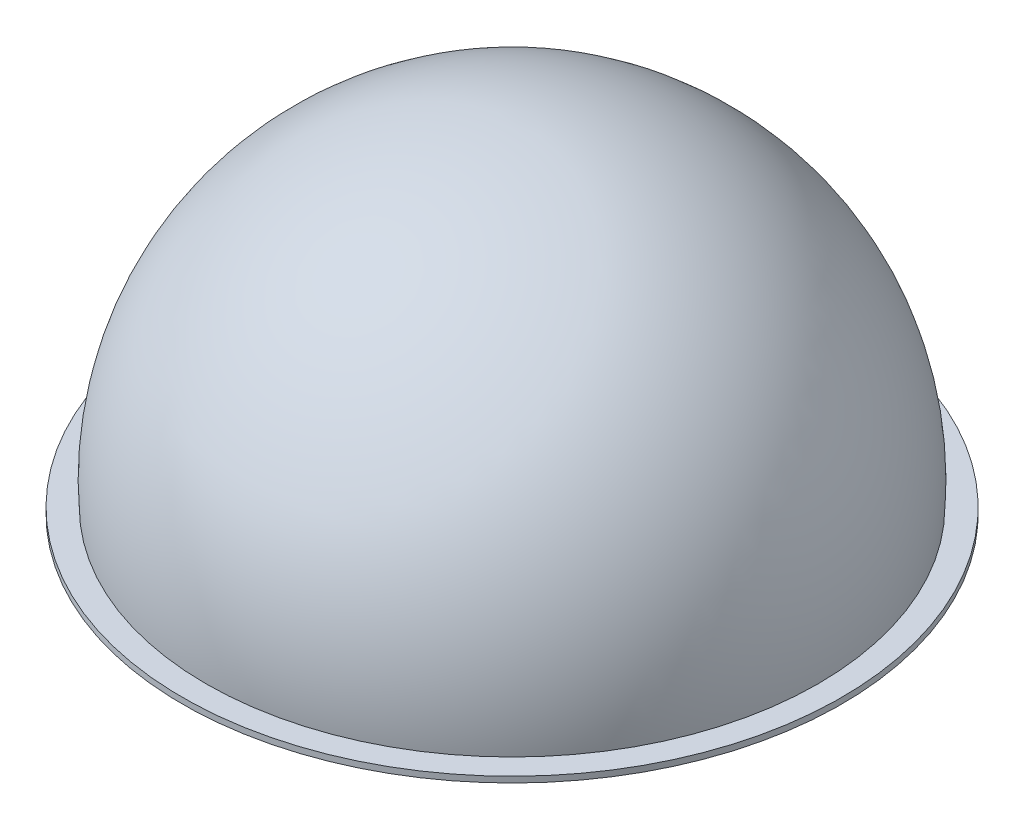
from build123d import *

# Parameters (mm, degrees)
SKETCH3_R           = 177.8
BOSS_EXTRUDE1_DEPTH = 3.175


# Read off the part's stored shape, not the designer's step: Shell1
with BuildPart() as part:
    # Sketch1 → Revolve1 (revolve)
    with BuildSketch(Plane.XY):
        with BuildLine():
            Line((0, 177.8), (0, 0))
            Line((0, 0), (165.1, 0))
            ThreePointArc((165.1, 0), (121.316579658, 124.897538254), (0, 177.8))
        make_face()
    revolve(axis=Axis((0, 177.8, 0), (0, -1, 0)))

    # Sketch3 → Boss-Extrude1 (add)
    with BuildSketch(Plane.XZ):
        with Locations(Location((0, 0, 0), (0, 0, 270))):
            Circle(SKETCH3_R)
    extrude(amount=BOSS_EXTRUDE1_DEPTH)

    # Shell1 outline → Shell1 (revolve, cut)
    with BuildSketch(Plane.XY):
        with BuildLine():
            ThreePointArc((161.64461017, -3.1750001), (120.147638379, 121.477126871), (0, 174.625))
            Line((0, 174.625), (0, -3.1750001))
            Line((0, -3.1750001), (161.64461017, -3.1750001))
        make_face()
    revolve(axis=Axis((0, 0, 0), (0, 1, 0)), mode=Mode.SUBTRACT)


solid = part.part
